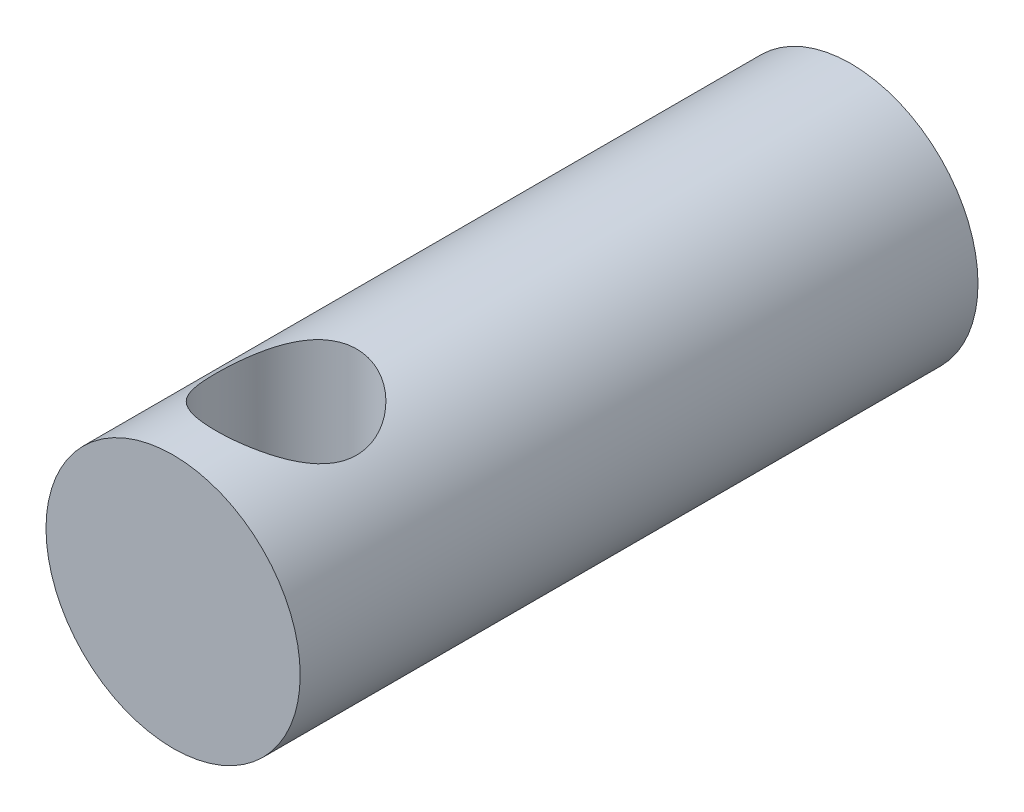
from build123d import *

# Parameters (mm, degrees)
SKETCH1_R               = 7.14375
BOSS_EXTRUDE1_DEPTH     = 38.1
SKETCH4_R               = 3.96875
CUT_EXTRUDE1_DEPTH      = 25.4
THREAD1_PITCH           = 1.411111111
CUT_EXTRUDE2_DEPTH      = 40.416701168
CUT_EXTRUDE2_DEPTH_BACK = 40.416701168
SKETCH7_R               = 3.96875


with BuildPart() as part:
    # Sketch1 → Boss-Extrude1 (new body)
    with BuildSketch(Plane.XY):
        with Locations(Location((0, 0, 0), (0, 0, 180))):
            Circle(SKETCH1_R)
    extrude(amount=BOSS_EXTRUDE1_DEPTH)

    # Sketch4 → Cut-Extrude1 (cut)
    with BuildSketch(Plane(origin=(0, 0, 0), x_dir=(-1, 0, 0), z_dir=(0, 0, -1))):
        Circle(SKETCH4_R)
    extrude(amount=-CUT_EXTRUDE1_DEPTH, mode=Mode.SUBTRACT)

    # Thread1: the profile of Thread Profile2 profile screwed along a right-hand helix of 18 turns, 8 arcs to a turn; built about Z, then put on its axis
    thread1_z = Axis((0, 0, 0), (0, 0, 1))
    thread1_corners = [(3.96905, 0, -0.000173205), (3.96905, 0, 1.234895423), (3.20496371, 0, 0.793749998), (3.20496371, 0, 0.44097222)]
    with BuildLine(mode=Mode.PRIVATE) as thread1_profile:
        Line(thread1_corners[0], thread1_corners[1])
        Line(thread1_corners[1], thread1_corners[2])
        Line(thread1_corners[2], thread1_corners[3])
        Line(thread1_corners[3], thread1_corners[0])
    thread1_cap = Face(thread1_profile.wire())
    thread1_turn_angles = [0, 22.5, 45, 67.5, 90, 112.5, 135, 157.5, 180, 202.5, 225, 247.5, 270, 292.5, 315, 337.5, 360]
    thread1_turn_weights = [1, 0.9238795325112867, 1, 0.9238795325112867, 1, 0.9238795325112867, 1, 0.9238795325112867, 1, 0.9238795325112867, 1, 0.9238795325112867, 1, 0.9238795325112867, 1, 0.9238795325112867, 1]
    thread1_turn_rails = [Edge.make_bspline([Vector(p[0], p[1], 0).rotate(thread1_z, thread1_turn_angles[k]) / thread1_turn_weights[k] + Vector(0, 0, p[2] + THREAD1_PITCH * thread1_turn_angles[k] / 360) for k in range(17)], [0, 0, 0, 1, 1, 2, 2, 3, 3, 4, 4, 5, 5, 6, 6, 7, 7, 8, 8, 8], 2, thread1_turn_weights) for p in thread1_corners]
    thread1_turn_sides = [Face.make_surface_from_curves(thread1_turn_rails[p[0]], thread1_turn_rails[p[1]]) for p in [(0, 1), (1, 2), (2, 3), (3, 0)]]
    thread1 = Plane(origin=(0, 0, 0), x_dir=(1, 0, 0), z_dir=(0, 0, 1)) * Solid(Shell([*[p.moved(Location((0, 0, THREAD1_PITCH * i))) for i in range(18) for p in thread1_turn_sides], thread1_cap, thread1_cap.rotate(thread1_z, 6480).moved(Location((0, 0, THREAD1_PITCH * 6480 / 360)))]))
    add(thread1)

    # Sketch7 → Cut-Extrude2 (cut, two sides: drawn at the far end of the back side and taken through both)
    with BuildSketch(Plane(origin=(0, 0, 0), x_dir=(1, 0, 0), z_dir=(0, 1, 0)).offset(-CUT_EXTRUDE2_DEPTH_BACK)):
        with Locations(Location((0, -31.75, 0), (0, 0, 270))):
            Circle(SKETCH7_R)
    extrude(amount=CUT_EXTRUDE2_DEPTH + CUT_EXTRUDE2_DEPTH_BACK, mode=Mode.SUBTRACT)


solid = part.part
